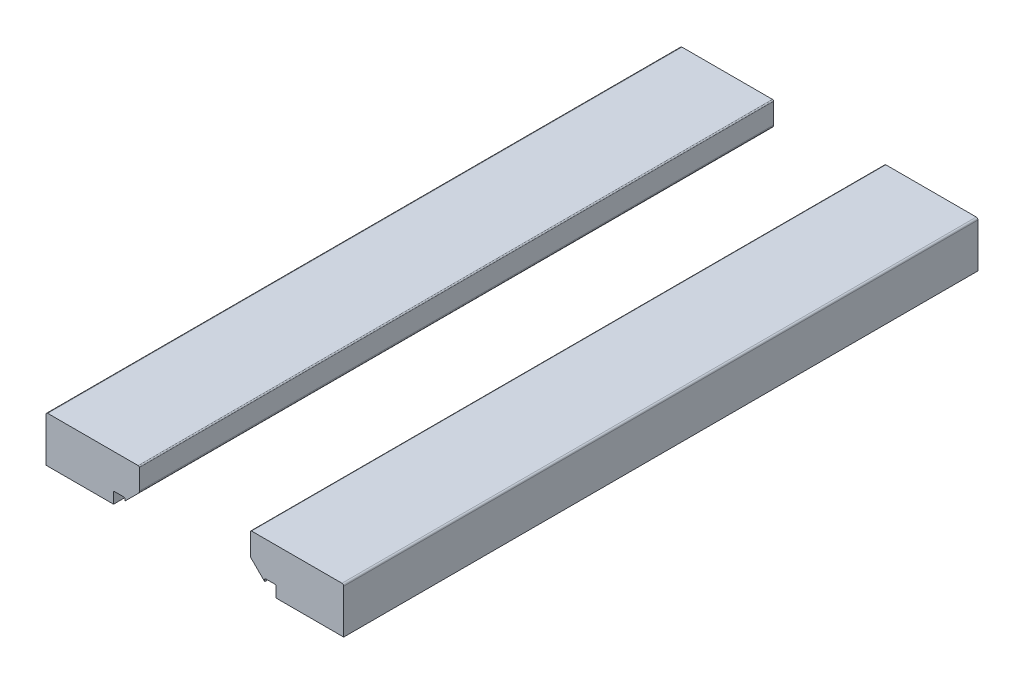
from build123d import *

# Parameters (mm, degrees)
RETAINERS_DEPTH   = 27.7
RETAINERS_2_DEPTH = 27.7


with BuildPart() as part:
    # Retainer Profile → Retainers (new, symmetric)
    with BuildSketch(Plane.XY):
        with BuildLine():
            Line((13, 8.15), (13, 4.3))
            Line((13, 4.3), (7.1, 4.3))
            Line((7.1, 4.3), (7.1, 5.2))
            ThreePointArc((7.1, 5.2), (7.070710678, 5.270710678), (7, 5.3))
            Line((7, 5.3), (6.2, 5.3))
            ThreePointArc((6.2, 5.3), (6.129289322, 5.270710678), (6.1, 5.2))
            Line((6.1, 5.2), (6.1, 5.041421356))
            Line((6.1, 5.041421356), (4.937867966, 6.203553391))
            ThreePointArc((4.937867966, 6.203553391), (4.87283614, 6.300880395), (4.85, 6.415685425))
            Line((4.85, 6.415685425), (4.85, 8.2))
            ThreePointArc((4.85, 8.2), (4.879289322, 8.270710678), (4.95, 8.3))
            Line((4.95, 8.3), (12.85, 8.3))
            ThreePointArc((12.85, 8.3), (12.956066017, 8.256066017), (13, 8.15))
        make_face()
    extrude(amount=RETAINERS_DEPTH, both=True)


with BuildPart() as body_2:
    # Retainer Profile → Retainers 2 (new, symmetric)
    with BuildSketch(Plane.XY):
        with BuildLine():
            Line((-4.937867966, 6.203553391), (-6.1, 5.041421356))
            Line((-6.1, 5.041421356), (-6.1, 5.2))
            ThreePointArc((-6.1, 5.2), (-6.129289322, 5.270710678), (-6.2, 5.3))
            Line((-6.2, 5.3), (-7, 5.3))
            ThreePointArc((-7, 5.3), (-7.070710678, 5.270710678), (-7.1, 5.2))
            Line((-7.1, 5.2), (-7.1, 4.3))
            Line((-7.1, 4.3), (-13, 4.3))
            Line((-13, 4.3), (-13, 8.15))
            ThreePointArc((-13, 8.15), (-12.956066017, 8.256066017), (-12.85, 8.3))
            Line((-12.85, 8.3), (-4.95, 8.3))
            ThreePointArc((-4.95, 8.3), (-4.879289322, 8.270710678), (-4.85, 8.2))
            Line((-4.85, 8.2), (-4.85, 6.415685425))
            ThreePointArc((-4.85, 6.415685425), (-4.87283614, 6.300880395), (-4.937867966, 6.203553391))
        make_face()
    extrude(amount=RETAINERS_2_DEPTH, both=True)


solid = Compound([part.part, body_2.part])
